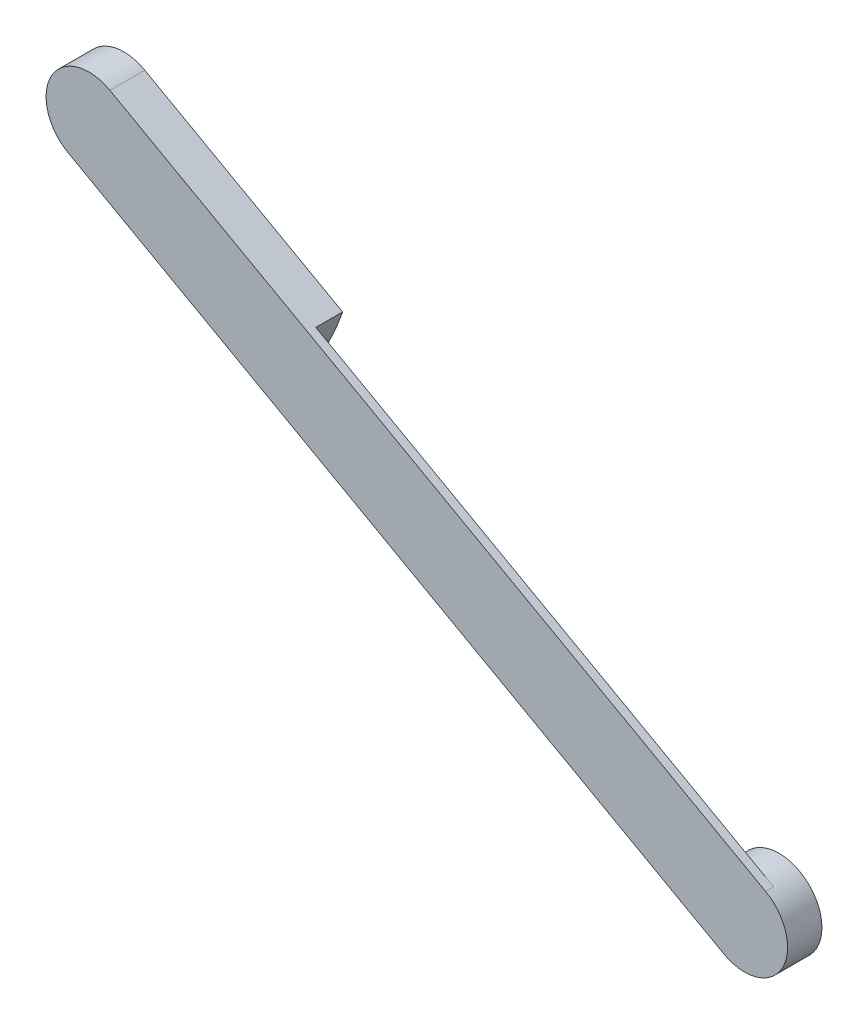
from build123d import *
from build123d.topology import SkipClean

# Parameters (mm, degrees)
ESQUISSE1_R        = 8
BOSS_EXTRU_1_DEPTH = 4.9
BOSS_EXTRU_2_START = 1.5
BOSS_EXTRU_2_DEPTH = 1.5
BOSS_EXTRU_3_DEPTH = 5


with BuildPart() as part:
    # Esquisse1 → Boss.-Extru.1 (new body)
    with BuildSketch(Plane.XY):
        with Locations((-10.25, -10)):
            Circle(ESQUISSE1_R)
        with BuildLine():
            Line((-5.751675839, -9.877200395), (-6.833750507, -9.782531128))
            Line((-6.833750507, -9.782531128), (-6.949445107, -9.126394451))
            Line((-6.949445107, -9.126394451), (-5.953521963, -8.661987862))
            ThreePointArc((-5.953521963, -8.661987862), (-6.006634107, -8.502052772), (-6.065697468, -8.344218516))
            Line((-6.065697468, -8.344218516), (-7.138261768, -8.631611254))
            Line((-7.138261768, -8.631611254), (-7.47139109, -8.054614344))
            Line((-7.47139109, -8.054614344), (-6.678798898, -7.262022153))
            ThreePointArc((-6.678798898, -7.262022153), (-6.782621037, -7.131675902), (-6.891198054, -7.005263035))
            Line((-6.891198054, -7.005263035), (-7.818046533, -7.654249327))
            Line((-7.818046533, -7.654249327), (-8.328430264, -7.225986526))
            Line((-8.328430264, -7.225986526), (-7.847635402, -6.194918616))
            ThreePointArc((-7.847635402, -6.194918616), (-7.988951343, -6.109285545), (-8.133315872, -6.028898352))
            Line((-8.133315872, -6.028898352), (-8.791112727, -6.968329619))
            Line((-8.791112727, -6.968329619), (-9.417191057, -6.740455742))
            Line((-9.417191057, -6.740455742), (-9.317216173, -5.597737589))
            ThreePointArc((-9.317216173, -5.597737589), (-9.478728542, -5.566588183), (-9.641271425, -5.541362369))
            Line((-9.641271425, -5.541362369), (-9.940094206, -6.656584169))
            Line((-9.940094206, -6.656584169), (-10.606352849, -6.656584169))
            Line((-10.606352849, -6.656584169), (-10.903477232, -5.547700874))
            ThreePointArc((-10.903477232, -5.547700874), (-11.065761738, -5.574558464), (-11.226956242, -5.607329229))
            Line((-11.226956242, -5.607329229), (-11.126406846, -6.756614081))
            Line((-11.126406846, -6.756614081), (-11.752485176, -6.984487958))
            Line((-11.752485176, -6.984487958), (-12.406540122, -6.050400691))
            ThreePointArc((-12.406540122, -6.050400691), (-12.550096477, -6.132241451), (-12.690551241, -6.219297732))
            Line((-12.690551241, -6.219297732), (-12.206963835, -7.256354271))
            Line((-12.206963835, -7.256354271), (-12.717347566, -7.684617071))
            Line((-12.717347566, -7.684617071), (-13.638885709, -7.039349117))
            ThreePointArc((-13.638885709, -7.039349117), (-13.74618945, -7.166864047), (-13.848697947, -7.298264801))
            Line((-13.848697947, -7.298264801), (-13.051434053, -8.095528695))
            Line((-13.051434053, -8.095528695), (-13.384563375, -8.672525605))
            Line((-13.384563375, -8.672525605), (-14.450903238, -8.3868007))
            ThreePointArc((-14.450903238, -8.3868007), (-14.508366703, -8.545244687), (-14.559856563, -8.705729393))
            Line((-14.559856563, -8.705729393), (-13.557961929, -9.172920534))
            Line((-13.557961929, -9.172920534), (-13.673656528, -9.829057211))
            Line((-13.673656528, -9.829057211), (-14.74934404, -9.923167674))
            ThreePointArc((-14.74934404, -9.923167674), (-14.749021481, -10.093838761), (-14.74222728, -10.264374865))
            Line((-14.74222728, -10.264374865), (-13.665452724, -10.358580432))
            Line((-13.665452724, -10.358580432), (-13.549758125, -11.014717109))
            Line((-13.549758125, -11.014717109), (-14.506309194, -11.460764198))
            ThreePointArc((-14.506309194, -11.460764198), (-14.447094307, -11.623083293), (-14.381691786, -11.78300953))
            Line((-14.381691786, -11.78300953), (-13.360941463, -11.509500306))
            Line((-13.360941463, -11.509500306), (-13.027812142, -12.086497216))
            Line((-13.027812142, -12.086497216), (-13.758807936, -12.817493011))
            ThreePointArc((-13.758807936, -12.817493011), (-13.646852578, -12.951506829), (-13.529782028, -13.081076086))
            Line((-13.529782028, -13.081076086), (-12.681156698, -12.486862233))
            Line((-12.681156698, -12.486862233), (-12.170772967, -12.915125033))
            Line((-12.170772967, -12.915125033), (-12.600738895, -13.837189942))
            ThreePointArc((-12.600738895, -13.837189942), (-12.448909121, -13.926168447), (-12.293716433, -14.009142444))
            Line((-12.293716433, -14.009142444), (-11.708090504, -13.172781941))
            Line((-11.708090504, -13.172781941), (-11.082012174, -13.400655818))
            Line((-11.082012174, -13.400655818), (-11.169878896, -14.404977051))
            ThreePointArc((-11.169878896, -14.404977051), (-10.996236031, -14.437694422), (-10.821442589, -14.463569577))
            Line((-10.821442589, -14.463569577), (-10.559109026, -13.48452739))
            Line((-10.559109026, -13.48452739), (-9.892850383, -13.48452739))
            Line((-9.892850383, -13.48452739), (-9.632173683, -14.457386077))
            ThreePointArc((-9.632173683, -14.457386077), (-9.45766281, -14.42969545), (-9.284373537, -14.395175256))
            Line((-9.284373537, -14.395175256), (-9.372796385, -13.384497479))
            Line((-9.372796385, -13.384497479), (-8.746718055, -13.156623602))
            Line((-8.746718055, -13.156623602), (-8.164782025, -13.987714383))
            ThreePointArc((-8.164782025, -13.987714383), (-8.010469052, -13.903139907), (-7.859580663, -13.812596936))
            Line((-7.859580663, -13.812596936), (-8.292239396, -12.884757289))
            Line((-8.292239396, -12.884757289), (-7.781855665, -12.456494489))
            Line((-7.781855665, -12.456494489), (-6.938532496, -13.046995729))
            ThreePointArc((-6.938532496, -13.046995729), (-6.822819391, -12.916236114), (-6.712266113, -12.78108593))
            Line((-6.712266113, -12.78108593), (-7.447769178, -12.045582865))
            Line((-7.447769178, -12.045582865), (-7.114639857, -11.468585954))
            Line((-7.114639857, -11.468585954), (-6.100183444, -11.740408731))
            ThreePointArc((-6.100183444, -11.740408731), (-6.036436962, -11.579837499), (-5.978900904, -11.416937723))
            Line((-5.978900904, -11.416937723), (-6.941241303, -10.968191026))
            Line((-6.941241303, -10.968191026), (-6.825546704, -10.312054348))
            Line((-6.825546704, -10.312054348), (-5.755303948, -10.21842024))
            ThreePointArc((-5.755303948, -10.21842024), (-5.750254354, -10.04784472), (-5.751675839, -9.877200395))
        make_face(mode=Mode.SUBTRACT)
    extrude(amount=-BOSS_EXTRU_1_DEPTH)

    # Esquisse2 → Boss.-Extru.2 (add)
    with SkipClean():  # the faces are left unmerged after this step: merging them gives an invalid solid
        with BuildSketch(Plane.XY.offset(BOSS_EXTRU_2_START)):
            with BuildLine():
                Line((-14.148674299, -16.985723922), (-136.398842928, 51.241076313))
                ThreePointArc((-136.398842928, 51.241076313), (-139.48589255, 62.125474534), (-128.601494329, 65.212524157))
                Line((-128.601494329, 65.212524157), (-6.351325701, -3.014276078))
                ThreePointArc((-6.351325701, -3.014276078), (-3.264276078, -13.898674299), (-14.148674299, -16.985723922))
            make_face()
        extrude(amount=-BOSS_EXTRU_2_DEPTH)
    add(part.part.scale(1), mode=Mode.REPLACE)  # the faces are merged on a copy

    # Esquisse3 → Boss.-Extru.3 (add)
    with BuildSketch(Plane(origin=(0, 0, 0), x_dir=(-1, 0, 0), z_dir=(0, 0, -1))):
        with BuildLine():
            ThreePointArc((136.398842928, 51.241076313), (139.48589255, 62.125474534), (128.601494329, 65.212524157))
            Line((128.601494329, 65.212524157), (91.708785743, 44.623010972))
            ThreePointArc((91.708785743, 44.623010972), (94.95190255, 37.271425877), (99.506134342, 30.651563128))
            Line((99.506134342, 30.651563128), (136.398842928, 51.241076313))
        make_face()
    extrude(amount=BOSS_EXTRU_3_DEPTH)


solid = part.part
